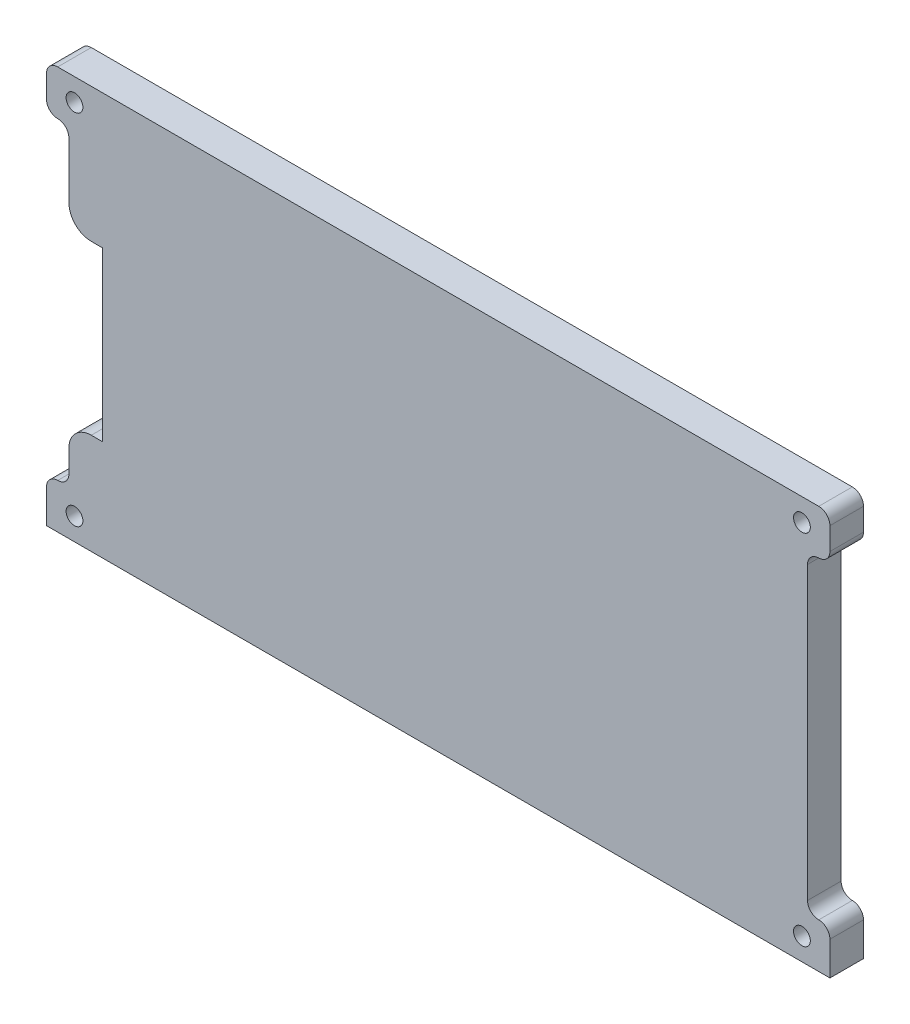
from build123d import *

# Parameters (mm, degrees)
SKETCH1_W           = 66
SKETCH1_H           = 36
BOSS_EXTRUDE1_DEPTH = 3
SKETCH2_W           = 2
SKETCH2_H           = 4
BOSS_EXTRUDE3_DEPTH = 3
SKETCH3_R           = 0.75
CUT_EXTRUDE1_DEPTH  = 40.471508712
SKETCH4_W           = 3
SKETCH4_H           = 15
CUT_EXTRUDE2_DEPTH  = 40.471508712
FILLET2_R           = 2
FILLET3_R           = 1


with BuildPart() as part:
    # Sketch1 → Boss-Extrude1 (new body)
    with BuildSketch(Plane.XY):
        Rectangle(SKETCH1_W, SKETCH1_H)
    extrude(amount=BOSS_EXTRUDE1_DEPTH)

    # Sketch2 → Boss-Extrude3 (add)
    with BuildSketch(Plane.XY.offset(3)):
        with Locations((-34, 16)):
            Rectangle(SKETCH2_W, SKETCH2_H)
        with Locations((-34, -16)):
            Rectangle(SKETCH2_W, SKETCH2_H)
        with Locations((34, 16)):
            Rectangle(SKETCH2_W, SKETCH2_H)
        with Locations((34, -16)):
            Rectangle(SKETCH2_W, SKETCH2_H)
    extrude(amount=-BOSS_EXTRUDE3_DEPTH)

    # Sketch3 → Cut-Extrude1 (cut, through all)
    with BuildSketch(Plane.XY.offset(3)):
        with Locations((-32.5, 16)):
            Circle(SKETCH3_R)
        with Locations(Location((-32.5, -16, 0), (0, 0, 180))):
            Circle(SKETCH3_R)
        with Locations((32.5, -16)):
            Circle(SKETCH3_R)
        with Locations(Location((32.5, 16, 0), (0, 0, 180))):
            Circle(SKETCH3_R)
    extrude(amount=-CUT_EXTRUDE1_DEPTH, mode=Mode.SUBTRACT)

    # Sketch4 → Cut-Extrude2 (cut, through all)
    with BuildSketch(Plane.XY.offset(3)):
        with Locations((-31.5, -1.5)):
            Rectangle(SKETCH4_W, SKETCH4_H)
    extrude(amount=-CUT_EXTRUDE2_DEPTH, mode=Mode.SUBTRACT)

    # Fillet2
    fillet2_edges = [part.edges().sort_by_distance(p)[0] for p in [
        (-33, -9, 1.5),
        (-33, 6, 1.5),
    ]]
    fillet(fillet2_edges, radius=FILLET2_R)

    # Fillet3
    fillet3_edges = [part.edges().sort_by_distance(p)[0] for p in [
        (35, -14, 1.5),
        (33, -14, 1.5),
        (33, 14, 1.5),
        (35, 14, 1.5),
        (35, 18, 1.5),
        (-35, 18, 1.5),
        (-35, 14, 1.5),
        (-33, 14, 1.5),
        (-33, -14, 1.5),
        (-35, -14, 1.5),
    ]]
    fillet(fillet3_edges, radius=FILLET3_R - 0.0001)  # a hair under: the kernel refuses the full size


solid = part.part
